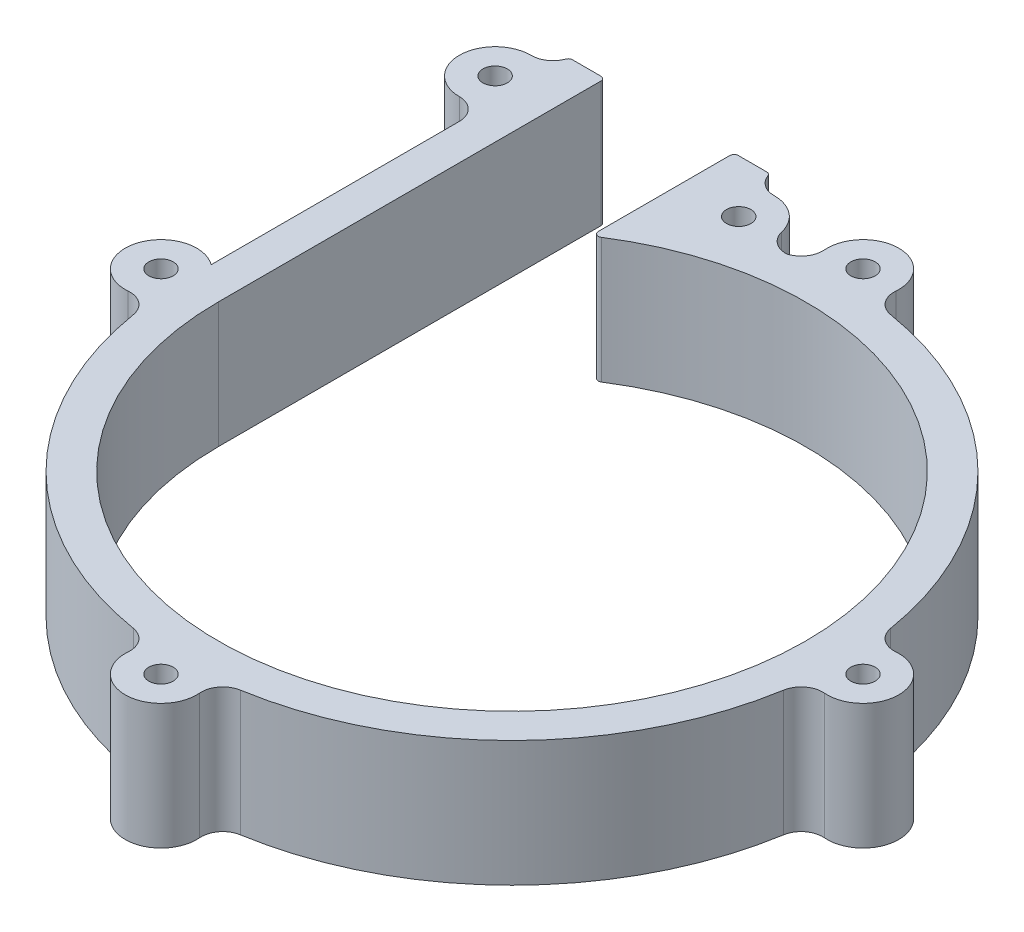
from build123d import *

# Parameters (mm, degrees)
SKETCH_1_R      = 1.7
EXTRUDE_1_DEPTH = 17.5
FILLET_1_R      = 3
FILLET_2_R      = 0.6


with BuildPart() as part:
    # 草图1 → 凸台-拉伸1 (new body)
    with BuildSketch(Plane(origin=(0, 0, 0), x_dir=(1, 0, 0), z_dir=(0, 1, 0))):
        with BuildLine():
            Line((-41, 0), (-41, 54))
            Line((-41, 54), (-46, 54))
            Line((-46, 54), (-46, 50.647615159))
            ThreePointArc((-46, 50.647615159), (-54, 46.647615159), (-46, 42.647615159))
            Line((-46, 42.647615159), (-46, 4))
            ThreePointArc((-46, 4), (-53.998925026, -0.103675394), (-45.836734694, -3.872176727))
            ThreePointArc((-45.836734694, -3.872176727), (-32.526911935, -32.526911935), (-3.872176727, -45.836734694))
            ThreePointArc((-3.872176727, -45.836734694), (0, -54), (3.872176727, -45.836734694))
            ThreePointArc((3.872176727, -45.836734694), (32.526911935, -32.526911935), (45.836734694, -3.872176727))
            ThreePointArc((45.836734694, -3.872176727), (54, 0), (45.836734694, 3.872176727))
            ThreePointArc((45.836734694, 3.872176727), (32.526911935, 32.526911935), (3.872176727, 45.836734694))
            ThreePointArc((3.872176727, 45.836734694), (0, 54), (-3.872176727, 45.836734694))
            ThreePointArc((-3.872176727, 45.836734694), (-7.126872346, 45.444556226), (-10.345371646, 44.821571654))
            ThreePointArc((-10.345371646, 44.821571654), (-11.971775359, 50.626290255), (-18, 50.647615159))
            Line((-18, 50.647615159), (-18, 54))
            Line((-18, 54), (-23, 54))
            Line((-23, 54), (-23, 33.941125497))
            ThreePointArc((-23, 33.941125497), (36.221540553, -19.209372712), (-41, 0))
        make_face()
        with Locations(Location((0, 49, 0), (0, 0, 270))):
            Circle(SKETCH_1_R, mode=Mode.SUBTRACT)
        with Locations(Location((49, 0, 0), (0, 0, 270))):
            Circle(SKETCH_1_R, mode=Mode.SUBTRACT)
        with Locations(Location((0, -49, 0), (0, 0, 270))):
            Circle(SKETCH_1_R, mode=Mode.SUBTRACT)
        with Locations(Location((-49, 0, 0), (0, 0, 270))):
            Circle(SKETCH_1_R, mode=Mode.SUBTRACT)
        with Locations(Location((-15, 46.647615159, 0), (0, 0, 270))):
            Circle(SKETCH_1_R, mode=Mode.SUBTRACT)
        with Locations(Location((-49, 46.647615159, 0), (0, 0, 270))):
            Circle(SKETCH_1_R, mode=Mode.SUBTRACT)
    extrude(amount=EXTRUDE_1_DEPTH)

    # 圆角1
    # the kernel refuses this fillet: 3 mm, written as the material it adds along each edge
    with BuildSketch(Plane(origin=(-3.872176727, 0, -45.836734694), x_dir=(-0.37402840247840613, 0, -0.9274172492138861), z_dir=(0, 1, 0)), Plane(origin=(45.836734694, 0, -3.872176727), x_dir=(0.9274172492138857, 0, -0.37402840247840763), z_dir=(0, 1, 0)), Plane(origin=(3.872176727, 0, 45.836734694), x_dir=(0.374028402478409, 0, 0.9274172492138849), z_dir=(0, 1, 0)), Plane(origin=(-45.836734694, 0, 3.872176727), x_dir=(-0.9274172492138864, 0, 0.3740284024784056), z_dir=(0, 1, 0))) as fillet_1_piece_1:
        with BuildLine():
            CenterArc((3.861943107, 2.864564734), FILLET_1_R, 167.400558819, 85.317583138)
            Line((0.934186439, 3.518965904), (0.875631305, 3.532053927))
            ThreePointArc((0.875631305, 3.532053927), (0.44393089, 1.765631899), (-0.057336629, 0.017677979))
            Line((-0.057336629, 0.017677979), (0.017824353, -0.057291295))
            ThreePointArc((0.017824353, -0.057291295), (1.485362734, 0.165725443), (2.952901114, -0.057291295))
            Line((2.952901114, -0.057291295), (2.970725467, 0))
        make_face()
    extrude(amount=17.5)
    with BuildSketch(Plane(origin=(3.872176727, 0, -45.836734694), x_dir=(0.9923388633046951, 0, 0.12354586344813656), z_dir=(0, 1, 0)), Plane(origin=(45.836734694, 0, 3.872176727), x_dir=(-0.12354586344813612, 0, 0.9923388633046951), z_dir=(0, 1, 0)), Plane(origin=(-3.872176727, 0, 45.836734694), x_dir=(-0.9923388633046952, 0, -0.12354586344813587), z_dir=(0, 1, 0)), Plane(origin=(-10.345371646, 0, -44.821571654), x_dir=(0.982518966413127, 0, -0.18616251136703332), z_dir=(0, 1, 0))) as fillet_1_piece_2:
        with BuildLine():
            CenterArc((3.759578561, 2.997649867), FILLET_1_R, 182.41437212, 85.317583138)
            Line((0.762241678, 2.871271047), (0.70229494, 2.868743471))
            ThreePointArc((0.70229494, 2.868743471), (0.541298099, 1.393112968), (-0.050799838, 0.031927676))
            Line((-0.050799838, 0.031927676), (0.002374471, -0.059952997))
            ThreePointArc((0.002374471, -0.059952997), (1.820427514, -0.023964621), (3.638480557, -0.059952997))
            Line((3.638480557, -0.059952997), (3.640855028, 0))
        make_face()
    extrude(amount=17.5)
    with BuildSketch(Plane(origin=(-46, 0, -42.647615159), x_dir=(-0.9486832980505127, 0, 0.31622776601684127), z_dir=(0, 1, 0))) as fillet_1_piece_3:
        with BuildLine():
            CenterArc((4.110960958, 2.846049894), FILLET_1_R, 161.565051177, 90)
            Line((1.264911064, 3.794733192), (1.207990066, 3.813706858))
            Line((1.207990066, 3.813706858), (-0.056920998, 0.018973666))
            Line((-0.056920998, 0.018973666), (0.018973666, -0.056920998))
            ThreePointArc((0.018973666, -0.056920998), (1.58113883, 0.19658351), (3.143303994, -0.056920998))
            Line((3.143303994, -0.056920998), (3.16227766, 0))
        make_face()
    extrude(amount=17.5)
    with BuildSketch(Plane(origin=(-46, 0, -50.647615159), x_dir=(1.5090941279718801e-12, 0, -1.0), z_dir=(0, 1, 0))) as fillet_1_piece_4:
        with BuildLine():
            CenterArc((3.99968789, 2.929334184), FILLET_1_R, 179.493886793, 78.04554374)
            Line((0.999804931, 2.955833865), (0.939807272, 2.956363859))
            ThreePointArc((0.939807272, 2.956363859), (0.679550236, 1.417151431), (-0.048, 0.036))
            Line((-0.048, 0.036), (0, -0.06))
            ThreePointArc((0, -0.06), (1.676192421, -0.06), (3.33943878, -0.058586684))
            Line((3.33943878, -0.058586684), (3.352384841, 0))
        make_face()
    extrude(amount=17.5)
    with BuildSketch(Plane(origin=(-18, 0, -50.647615159), x_dir=(0.9472773756522823, 0, -0.3204146900148692), z_dir=(0, 1, 0))) as fillet_1_piece_5:
        with BuildLine():
            CenterArc((4.056450754, 2.850212144), FILLET_1_R, 173.772564041, 78.04554374)
            Line((1.07415335, 3.175638315), (1.014507402, 3.182146838))
            ThreePointArc((1.014507402, 3.182146838), (0.480240032, 1.607044039), (-0.056836643, 0.019224881))
            Line((-0.056836643, 0.019224881), (0.01872208, -0.057004243))
            ThreePointArc((0.01872208, -0.057004243), (1.560173367, 0.189646427), (3.101624653, -0.057004243))
            Line((3.101624653, -0.057004243), (3.120346734, 0))
        make_face()
    extrude(amount=17.5)

    # 圆角2
    fillet_2_edges = [part.edges().sort_by_distance(p)[0] for p in [
        (-46, 8.75, -54),
        (-41, 8.75, -54),
        (-23, 8.75, -33.941125497),
        (-23, 8.75, -54),
        (-18, 8.75, -54),
    ]]
    fillet(fillet_2_edges, radius=FILLET_2_R)


solid = part.part
